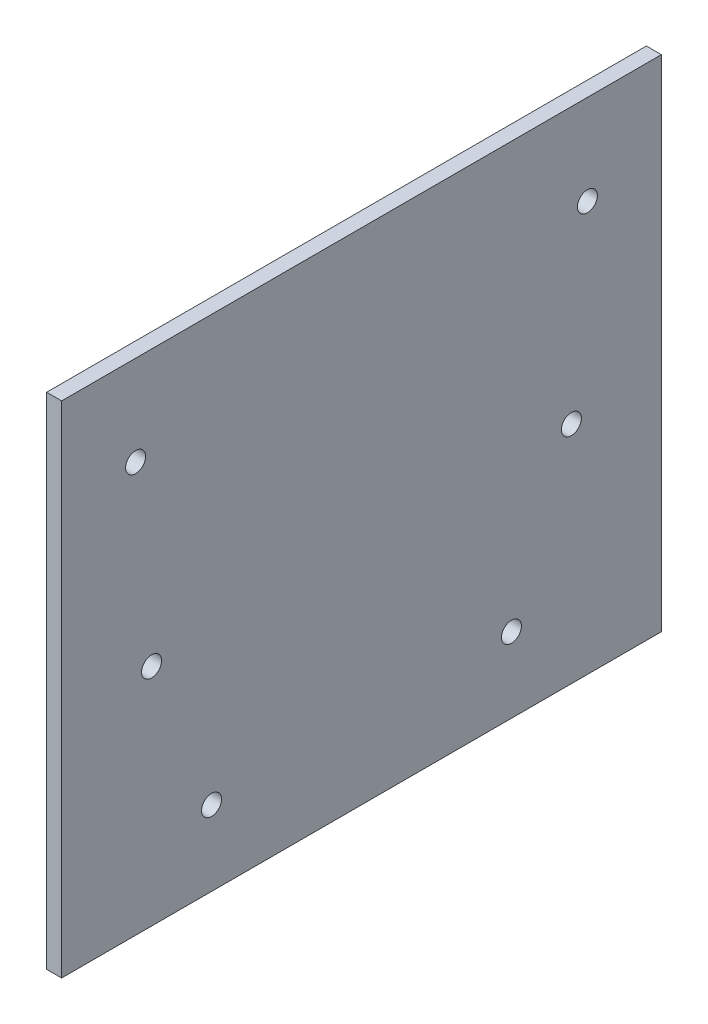
from build123d import *

# Parameters (mm, degrees)
SKETCH1_W           = 120
SKETCH1_H           = 100
BOSS_EXTRUDE1_DEPTH = 3
SKETCH2_R           = 2
CUT_EXTRUDE1_DEPTH  = 100.659965395
SKETCH3_R           = 2
CUT_EXTRUDE2_DEPTH  = 100.659965395
SKETCH4_R           = 2
CUT_EXTRUDE3_DEPTH  = 100.659965395


with BuildPart() as part:
    # Sketch1 → Boss-Extrude1 (new body)
    with BuildSketch(Plane(origin=(0, 0, 0), x_dir=(0, 0, -1), z_dir=(1, 0, 0))):
        with Locations((26.146465375, -0.01894847)):
            Rectangle(SKETCH1_W, SKETCH1_H)
    extrude(amount=BOSS_EXTRUDE1_DEPTH)

    # Sketch2 → Cut-Extrude1 (cut, through all)
    with BuildSketch(Plane(origin=(3, 0, 0), x_dir=(0, 0, -1), z_dir=(1, 0, 0))):
        with Locations((-3.853534625, -35.01894847)):
            Circle(SKETCH2_R)
        with Locations((56.146465375, -35.01894847)):
            Circle(SKETCH2_R)
    extrude(amount=-CUT_EXTRUDE1_DEPTH, mode=Mode.SUBTRACT)

    # Sketch3 → Cut-Extrude2 (cut, through all)
    with BuildSketch(Plane.ZY):
        with Locations((-68.146465375, -5.01894847)):
            Circle(SKETCH3_R)
        with Locations((15.853534625, -5.01894847)):
            Circle(SKETCH3_R)
    extrude(amount=-CUT_EXTRUDE2_DEPTH, mode=Mode.SUBTRACT)

    # Sketch4 → Cut-Extrude3 (cut, through all)
    with BuildSketch(Plane.ZY):
        with Locations((19.055575654, 31.98105153)):
            Circle(SKETCH4_R)
        with Locations((-71.348506404, 31.98105153)):
            Circle(SKETCH4_R)
    extrude(amount=-CUT_EXTRUDE3_DEPTH, mode=Mode.SUBTRACT)


solid = part.part
